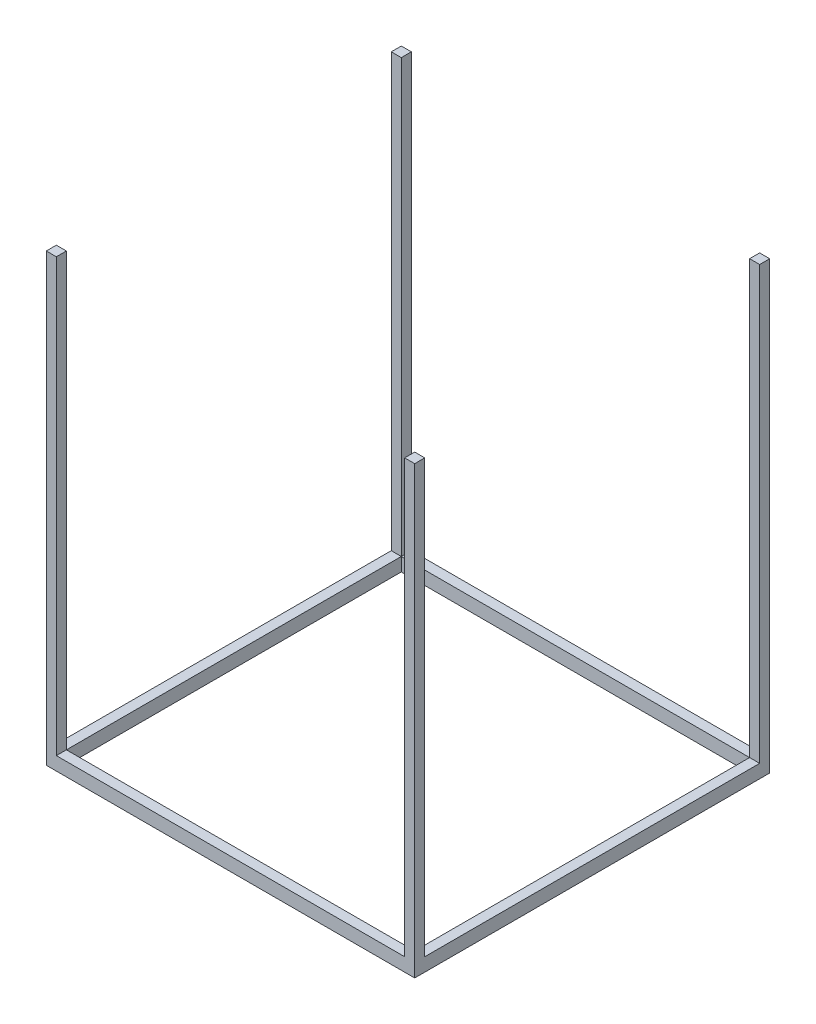
from build123d import *

# Parameters (mm, degrees)
SKETCH1_W           = 1397
SKETCH1_H           = 1346.2
SKETCH1_W_2         = 1320.8
SKETCH1_H_2         = 1270
BOSS_EXTRUDE1_DEPTH = 50.8
SKETCH1_3_W         = 38.1
SKETCH1_3_H         = 38.1
BOSS_EXTRUDE2_DEPTH = 1689.1


with BuildPart() as part:
    # Sketch1 → Boss-Extrude1 (new body)
    with BuildSketch(Plane(origin=(0, 0, 0), x_dir=(1, 0, 0), z_dir=(0, 1, 0))):
        Rectangle(SKETCH1_W, SKETCH1_H)
        Rectangle(SKETCH1_W_2, SKETCH1_H_2, mode=Mode.SUBTRACT)
    extrude(amount=BOSS_EXTRUDE1_DEPTH)

    # Sketch1<3> → Boss-Extrude2 (add)
    with BuildSketch(Plane(origin=(0, 0, 0), x_dir=(1, 0, 0), z_dir=(0, 1, 0))):
        with Locations((-679.45, 654.05)):
            Rectangle(SKETCH1_3_W, SKETCH1_3_H)
        with Locations((-679.45, -654.05)):
            Rectangle(SKETCH1_3_W, SKETCH1_3_H)
        with Locations((679.45, 654.05)):
            Rectangle(SKETCH1_3_W, SKETCH1_3_H)
        with Locations((679.45, -654.05)):
            Rectangle(SKETCH1_3_W, SKETCH1_3_H)
    extrude(amount=BOSS_EXTRUDE2_DEPTH)


solid = part.part
